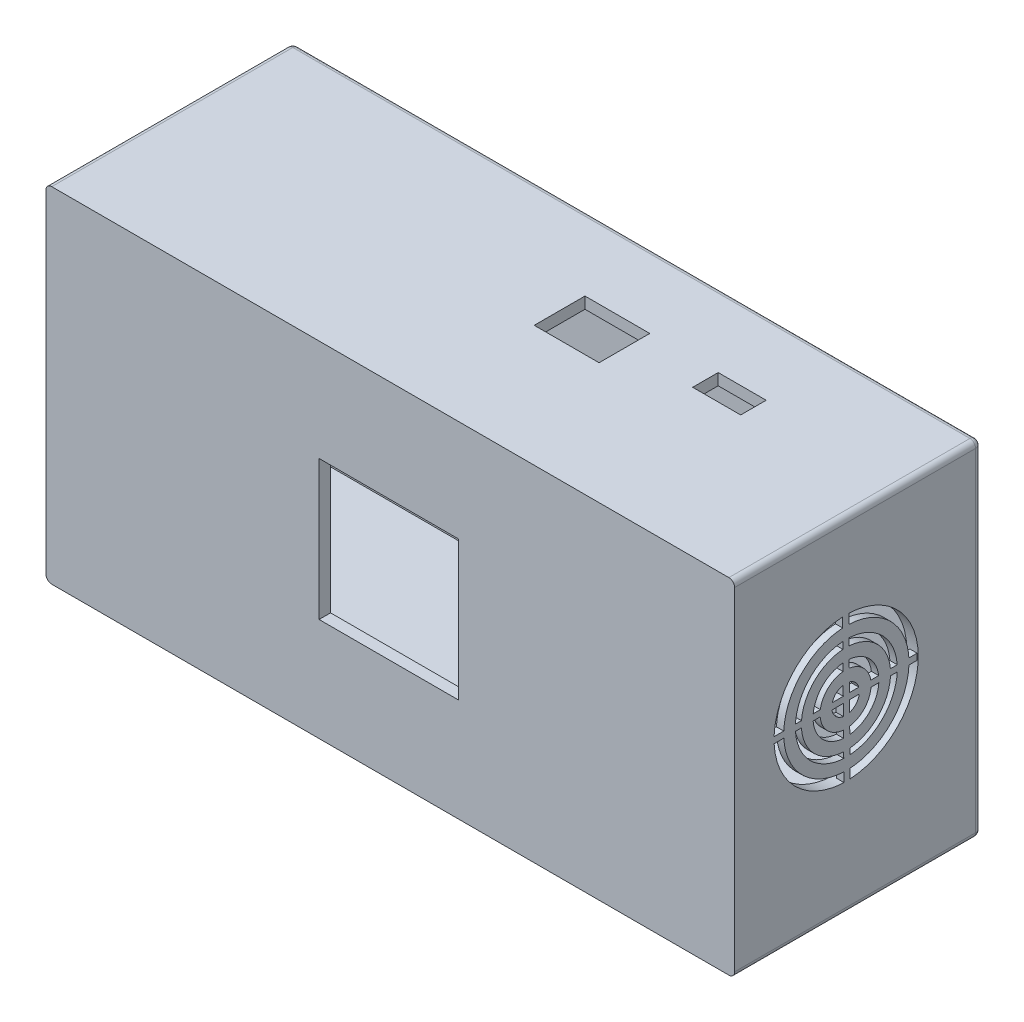
from build123d import *

# Parameters (mm, degrees)
BOSS_EXTRUDE2_DEPTH      = 30
BOSS_EXTRUDE2_DEPTH_BACK = 10
SKETCH2_W                = 120
SKETCH2_H                = 60
SHELL13_T                = -2
FILLET1_R                = 1
SKETCH4_W                = 8.361444153
SKETCH4_H                = 4.445115568
CUT_EXTRUDE1_DEPTH       = 9
SKETCH5_W                = 11.295048397
SKETCH5_H                = 8.838555995
CUT_EXTRUDE2_DEPTH       = 14
VENT2_START              = 134.27224921
VENT2_DEPTH              = 2
VENT2_2_DEPTH            = 0.73
SKETCH10_W               = 24.3
SKETCH10_H               = 24.3
CUT_EXTRUDE3_DEPTH       = 6
BOSS_EXTRUDE5_DEPTH      = 3
FILLET2_R                = 1


# Read off the part's stored shape, not the designer's step: Vent2
with BuildPart() as part:
    # Sketch2 → Boss-Extrude2 (new, two sides: drawn at the far end of the back side and taken through both)
    with BuildSketch(Plane.XY.offset(-BOSS_EXTRUDE2_DEPTH_BACK)):
        with Locations((76.27224921, 49.186903688)):
            Rectangle(SKETCH2_W, SKETCH2_H)
    extrude(amount=BOSS_EXTRUDE2_DEPTH + BOSS_EXTRUDE2_DEPTH_BACK)

    # Shell13
    shell13_openings = [part.faces().sort_by_distance(p)[0] for p in [
        (76.27224921, 49.186903688, -10),
    ]]
    offset(amount=SHELL13_T, openings=shell13_openings, kind=Kind.INTERSECTION)

    # Fillet1
    fillet1_edges = [part.edges().sort_by_distance(p)[0] for p in [
        (16.27224921, 79.186903688, 10),
        (136.27224921, 79.186903688, 10),
        (136.27224921, 19.186903688, 10),
        (16.27224921, 19.186903688, 10),
    ]]
    fillet(fillet1_edges, radius=FILLET1_R)

    # Sketch4 → Cut-Extrude1 (cut)
    with BuildSketch(Plane(origin=(0, 79.186903688, 0), x_dir=(1, 0, 0), z_dir=(0, 1, 0))):
        with Locations((107.573936677, -2.207545793)):
            Rectangle(SKETCH4_W, SKETCH4_H)
    extrude(amount=-CUT_EXTRUDE1_DEPTH, mode=Mode.SUBTRACT)

    # Sketch5 → Cut-Extrude2 (cut)
    with BuildSketch(Plane(origin=(0, 79.186903688, 0), x_dir=(1, 0, 0), z_dir=(0, 1, 0))):
        with Locations((85.887283166, -4.464716732)):
            Rectangle(SKETCH5_W, SKETCH5_H)
    extrude(amount=-CUT_EXTRUDE2_DEPTH, mode=Mode.SUBTRACT)

    # Vent2 outline → Vent2 (cut)
    with BuildSketch(Plane.YZ.offset(VENT2_START)):
        with BuildLine():
            add(Edge.make_bspline(
                [(39.248170727, 9.867726147), (39.280937663, 9.278831556), (39.458602574, 7.874335052), (40.110393686, 5.725667709), (41.279007407, 3.539345213), (42.851696903, 1.623017518), (44.768024598, 0.050328023), (46.954347093, -1.118285698), (49.326645243, -1.837914474), (50.971383719, -1.999907075), (51.793752958, -1.999907075)],
                knots=[0.758837586, 0.758837586, 0.758837586, 0.758837586, 0.78125, 0.8125, 0.84375, 0.875, 0.90625, 0.9375, 0.96875, 1, 1, 1, 1], degree=3))
            add(Edge.make_bspline(
                [(51.793752958, -1.999907075), (52.616122196, -1.999907075), (54.260860673, -1.837914474), (56.633158822, -1.118285698), (58.819481318, 0.050328023), (60.735809013, 1.623017518), (62.308498508, 3.539345213), (63.477112229, 5.725667709), (64.151568432, 7.949051843), (64.325410606, 9.433533895), (64.350126891, 10.100582883)],
                knots=[0, 0, 0, 0, 0.03125, 0.0625, 0.09375, 0.125, 0.15625, 0.1875, 0.21875, 0.24411512, 0.24411512, 0.24411512, 0.24411512], degree=3))
            Line((64.350126891, 10.100582883), (62.670243261, 10.084999581))
            add(Edge.make_bspline(
                [(52.380334311, -0.368908259), (52.887508336, -0.340055386), (54.10332287, -0.185490504), (55.96610058, 0.379576937), (57.865956786, 1.395071236), (59.531194679, 2.761696656), (60.897820099, 4.426934548), (61.913314398, 6.326790755), (62.495168538, 8.244906796), (62.647050219, 9.519932466), (62.670243261, 10.084999581)],
                knots=[0.009035738, 0.009035738, 0.009035738, 0.009035738, 0.03125, 0.0625, 0.09375, 0.125, 0.15625, 0.1875, 0.21875, 0.243480904, 0.243480904, 0.243480904, 0.243480904], degree=3))
            Line((52.380334311, -0.368908259), (52.388470355, -1.792712054))
            Line((52.388470355, -1.792712054), (51.308487987, -1.798883382))
            Line((51.308487987, -1.798883382), (51.300361801, -0.376797184))
            add(Edge.make_bspline(
                [(40.861511133, 9.882692243), (40.891158739, 9.385553011), (41.046097527, 8.179979941), (41.608256321, 6.326790755), (42.62375062, 4.426934548), (43.99037604, 2.761696656), (45.655613933, 1.395071236), (47.555470139, 0.379576937), (49.469314036, -0.200981262), (50.739762235, -0.353101983), (51.300361801, -0.376797184)],
                knots=[0.759471799, 0.759471799, 0.759471799, 0.759471799, 0.78125, 0.8125, 0.84375, 0.875, 0.90625, 0.9375, 0.96875, 0.993286618, 0.993286618, 0.993286618, 0.993286618], degree=3))
            Line((40.861511133, 9.882692243), (39.248170727, 9.867726147))
        make_face()
        with BuildLine():
            Line((62.661034502, 11.164960564), (64.343621962, 11.180569007))
            add(Edge.make_bspline(
                [(64.343621962, 11.180569007), (64.313355134, 11.796952588), (64.136872655, 13.229540791), (63.477112229, 15.404479438), (62.308498508, 17.590801933), (60.735809013, 19.507129628), (58.819481318, 21.079819124), (56.633158822, 22.248432845), (54.40588016, 22.92407044), (52.917221216, 23.097674464), (52.246101191, 23.121891543)],
                knots=[0.257799379, 0.257799379, 0.257799379, 0.257799379, 0.28125, 0.3125, 0.34375, 0.375, 0.40625, 0.4375, 0.46875, 0.494269027, 0.494269027, 0.494269027, 0.494269027], degree=3))
            Line((52.246101191, 23.121891543), (52.255714862, 21.439495978))
            add(Edge.make_bspline(
                [(62.661034502, 11.164960564), (62.631820789, 11.667664065), (62.477086008, 12.878915266), (61.913314398, 14.737421195), (60.897820099, 16.637277402), (59.531194679, 18.302515294), (57.865956786, 19.669140715), (55.96610058, 20.684635014), (54.063327221, 21.261835002), (52.804735823, 21.414550319), (52.255714862, 21.439495978)],
                knots=[0.259230008, 0.259230008, 0.259230008, 0.259230008, 0.28125, 0.3125, 0.34375, 0.375, 0.40625, 0.4375, 0.46875, 0.492783159, 0.492783159, 0.492783159, 0.492783159], degree=3))
        make_face()
        with BuildLine():
            add(Edge.make_bspline(
                [(51.166126705, 23.114341033), (50.55381606, 23.083681115), (49.125392776, 22.907012352), (46.954347093, 22.248432845), (44.768024598, 21.079819124), (42.851696903, 19.507129628), (41.279007407, 17.590801933), (40.110393686, 15.404479438), (39.427968143, 13.154823911), (39.255807145, 11.642150859), (39.234611352, 10.947646831)],
                knots=[0.507953224, 0.507953224, 0.507953224, 0.507953224, 0.53125, 0.5625, 0.59375, 0.625, 0.65625, 0.6875, 0.71875, 0.74515333, 0.74515333, 0.74515333, 0.74515333], degree=3))
            Line((39.234611352, 10.947646831), (40.850659779, 10.96263799))
            add(Edge.make_bspline(
                [(51.175722808, 21.435027445), (50.656963919, 21.407160408), (49.429318363, 21.253060658), (47.555470139, 20.684635014), (45.655613933, 19.669140715), (43.99037604, 18.302515294), (42.62375062, 16.637277402), (41.608256321, 14.737421195), (41.024789359, 12.813988393), (40.873212619, 11.533264495), (40.850659779, 10.96263799)],
                knots=[0.50853228, 0.50853228, 0.50853228, 0.50853228, 0.53125, 0.5625, 0.59375, 0.625, 0.65625, 0.6875, 0.71875, 0.743722697, 0.743722697, 0.743722697, 0.743722697], degree=3))
            Line((51.175722808, 21.435027445), (51.166126705, 23.114341033))
        make_face()
        with BuildLine():
            Line((51.49540607, 23.126502834), (51.948866287, 23.129094035))
            add(Edge.make_bspline(
                [(51.948866287, 23.129094035), (51.897164462, 23.129734031), (51.74600043, 23.130670123), (51.594836397, 23.128869508), (51.49540607, 23.126502834)],
                knots=[0.498035183, 0.498035183, 0.498035183, 0.498035183, 0.5, 0.503779411, 0.503779411, 0.503779411, 0.503779411], degree=3))
        make_face()
        with BuildLine():
            Line((51.235014551, 11.058967826), (51.223655638, 13.046777745))
            add(Edge.make_bspline(
                [(51.223655638, 13.046777745), (51.20159643, 13.04304306), (51.023956897, 13.010369071), (50.69850441, 12.910670807), (50.277256195, 12.687050931), (49.909554957, 12.383598671), (49.605947975, 12.015796131), (49.382362479, 11.594729628), (49.279713356, 11.259781995), (49.246422345, 11.072360016), (49.241426593, 11.040474431)],
                knots=[0.526810101, 0.526810101, 0.526810101, 0.526810101, 0.531231233, 0.562499636, 0.593731233, 0.624999636, 0.656231232, 0.687499636, 0.718731232, 0.725108759, 0.725108759, 0.725108759, 0.725108759], degree=3))
            Line((49.241426593, 11.040474431), (51.235014551, 11.058967826))
        make_face()
        with BuildLine():
            add(Edge.make_bspline(
                [(51.211966215, 15.092966778), (51.060663035, 15.078721907), (50.621605753, 15.014614553), (49.915539117, 14.800431581), (49.141478774, 14.386687708), (48.463009209, 13.829882126), (47.906203627, 13.151412561), (47.492459753, 12.377352218), (47.272475493, 11.652161297), (47.208546091, 11.192790385), (47.194729727, 11.021485687)],
                knots=[0.514938952, 0.514938952, 0.514938952, 0.514938952, 0.53125, 0.5625, 0.59375, 0.625, 0.65625, 0.6875, 0.71875, 0.737195698, 0.737195698, 0.737195698, 0.737195698], degree=3))
            Line((51.211966215, 15.092966778), (51.204938684, 16.322249183))
            add(Edge.make_bspline(
                [(51.204938684, 16.322249183), (50.982281858, 16.304468753), (50.387751024, 16.221970063), (49.450180919, 15.937561281), (48.450989448, 15.403482313), (47.575190799, 14.684732937), (46.856441423, 13.808934288), (46.322362455, 12.809742818), (46.033547307, 11.857646871), (45.951353916, 11.247652989), (45.934245061, 11.009795534)],
                knots=[0.51267793, 0.51267793, 0.51267793, 0.51267793, 0.53125, 0.5625, 0.59375, 0.625, 0.65625, 0.6875, 0.71875, 0.738578126, 0.738578126, 0.738578126, 0.738578126], degree=3))
            Line((45.934245061, 11.009795534), (47.194729727, 11.021485687))
        make_face()
        with BuildLine():
            Line((51.241185918, 9.978978607), (49.316567476, 9.961125017))
            add(Edge.make_bspline(
                [(49.316567476, 9.961125017), (49.339540747, 9.88593295), (49.419747427, 9.662873816), (49.605840344, 9.312317375), (49.909292887, 8.944617186), (50.277094371, 8.641006293), (50.698206996, 8.417413003), (51.032662666, 8.314881809), (51.21957636, 8.281625953), (51.250913245, 8.27669649)],
                knots=[0.79696703, 0.79696703, 0.79696703, 0.79696703, 0.812499636, 0.843731232, 0.874999635, 0.906231232, 0.937499635, 0.968740621, 0.975009024, 0.975009024, 0.975009024, 0.975009024], degree=3))
            Line((51.250913245, 8.27669649), (51.241185918, 9.978978607))
        make_face()
        with BuildLine():
            add(Edge.make_bspline(
                [(47.239330665, 9.941856548), (47.247343897, 9.893128105), (47.308200527, 9.558021785), (47.492459753, 8.950600519), (47.906203627, 8.176540176), (48.463009209, 7.498070611), (49.141478774, 6.941265029), (49.915539117, 6.527521155), (50.637900114, 6.308395342), (51.094261818, 6.244423062), (51.262605771, 6.230509649)],
                knots=[0.775949733, 0.775949733, 0.775949733, 0.775949733, 0.78125, 0.8125, 0.84375, 0.875, 0.90625, 0.9375, 0.96875, 0.986879822, 0.986879822, 0.986879822, 0.986879822], degree=3))
            Line((47.239330665, 9.941856548), (45.958458963, 9.929973722))
            add(Edge.make_bspline(
                [(45.958458963, 9.929973722), (45.976213387, 9.778362814), (46.058581332, 9.255909351), (46.322362455, 8.386339526), (46.856441423, 7.387148055), (47.575190799, 6.511349406), (48.450989448, 5.79260003), (49.450180919, 5.258521062), (50.408785842, 4.967731438), (51.025716232, 4.88571291), (51.270385933, 4.868982505)],
                knots=[0.768557942, 0.768557942, 0.768557942, 0.768557942, 0.78125, 0.8125, 0.84375, 0.875, 0.90625, 0.9375, 0.96875, 0.98914096, 0.98914096, 0.98914096, 0.98914096], degree=3))
            Line((51.270385933, 4.868982505), (51.262605771, 6.230509649))
        make_face()
        with BuildLine():
            Line((52.321146304, 9.988996792), (52.330504799, 8.35126018))
            add(Edge.make_bspline(
                [(52.330504799, 8.35126018), (52.406129897, 8.374314763), (52.629631041, 8.45459332), (52.980572907, 8.640904881), (53.348275198, 8.944353242), (53.651881898, 9.312156826), (53.845067399, 9.675972294), (53.928299986, 9.914170555), (53.953973461, 10.004151)],
                knots=[0.046880456, 0.046880456, 0.046880456, 0.046880456, 0.062499637, 0.093731233, 0.124999636, 0.156231233, 0.187499636, 0.205986908, 0.205986908, 0.205986908, 0.205986908], degree=3))
            Line((53.953973461, 10.004151), (52.321146304, 9.988996792))
        make_face()
        with BuildLine():
            add(Edge.make_bspline(
                [(52.342380699, 6.272977693), (52.394010027, 6.281363432), (52.732058919, 6.342409333), (53.342290816, 6.527521155), (54.116351159, 6.941265029), (54.794820724, 7.498070611), (55.351626306, 8.176540176), (55.765370179, 8.950600519), (55.957654118, 9.584475715), (56.020067765, 9.947322468), (56.031135508, 10.023416235)],
                knots=[0.025636011, 0.025636011, 0.025636011, 0.025636011, 0.03125, 0.0625, 0.09375, 0.125, 0.15625, 0.1875, 0.21875, 0.227003051, 0.227003051, 0.227003051, 0.227003051], degree=3))
            Line((52.342380699, 6.272977693), (52.350243254, 4.897030574))
            add(Edge.make_bspline(
                [(52.350243254, 4.897030574), (52.495027084, 4.914507316), (53.010564601, 4.996726926), (53.873584211, 5.258521062), (54.872775681, 5.79260003), (55.74857433, 6.511349406), (56.467323706, 7.387148055), (57.001402674, 8.386339526), (57.275542063, 9.290055977), (57.358297, 9.848639475), (57.376716608, 10.035894499)],
                knots=[0.019124342, 0.019124342, 0.019124342, 0.019124342, 0.03125, 0.0625, 0.09375, 0.125, 0.15625, 0.1875, 0.21875, 0.234394731, 0.234394731, 0.234394731, 0.234394731], degree=3))
            Line((57.376716608, 10.035894499), (56.031135508, 10.023416235))
        make_face()
        with BuildLine():
            add(Edge.make_bspline(
                [(56.055703794, 11.103683561), (56.041436032, 11.247327412), (55.977330048, 11.678614173), (55.765370179, 12.377352218), (55.351626306, 13.151412561), (54.794820724, 13.829882126), (54.116351159, 14.386687708), (53.342290816, 14.800431581), (52.715762446, 14.990486884), (52.360629829, 15.052518485), (52.292149312, 15.062839328)],
                knots=[0.265756968, 0.265756968, 0.265756968, 0.265756968, 0.28125, 0.3125, 0.34375, 0.375, 0.40625, 0.4375, 0.46875, 0.476182999, 0.476182999, 0.476182999, 0.476182999], degree=3))
            Line((56.055703794, 11.103683561), (57.380892972, 11.115979665))
            add(Edge.make_bspline(
                [(57.380892972, 11.115979665), (57.362584345, 11.318112644), (57.279859511, 11.891793645), (57.001402674, 12.809742818), (56.467323706, 13.808934288), (55.74857433, 14.684732937), (54.872775681, 15.403482313), (53.873584211, 15.937561281), (52.989528267, 16.20573672), (52.451763006, 16.288348009), (52.285040884, 16.306545063)],
                knots=[0.26437456, 0.26437456, 0.26437456, 0.26437456, 0.28125, 0.3125, 0.34375, 0.375, 0.40625, 0.4375, 0.46875, 0.482694679, 0.482694679, 0.482694679, 0.482694679], degree=3))
            Line((52.285040884, 16.306545063), (52.292149312, 15.062839328))
        make_face()
        with BuildLine():
            Line((52.314974937, 11.068986011), (54.009045181, 11.084700948))
            add(Edge.make_bspline(
                [(54.009045181, 11.084700948), (54.006071592, 11.101582503), (53.973767552, 11.273961959), (53.875609406, 11.594386924), (53.651989529, 12.01563514), (53.348537269, 12.383336378), (52.980734729, 12.68694336), (52.621624544, 12.87763017), (52.388743524, 12.959841185), (52.304020676, 12.984620421)],
                knots=[0.277843885, 0.277843885, 0.277843885, 0.277843885, 0.281231233, 0.312499636, 0.343731233, 0.374999636, 0.406231233, 0.437499636, 0.454939434, 0.454939434, 0.454939434, 0.454939434], degree=3))
            Line((52.304020676, 12.984620421), (52.314974937, 11.068986011))
        make_face()
        with BuildLine():
            add(Edge.make_bspline(
                [(51.193303967, 18.358323316), (50.841398777, 18.337056221), (49.985106618, 18.22666083), (48.667555542, 17.826986081), (47.314793506, 17.103919708), (46.129087664, 16.130836072), (45.156004028, 14.945130231), (44.432937656, 13.592368195), (44.025889453, 12.2505101), (43.916509367, 11.368242295), (43.897394672, 10.990900836)],
                knots=[0.509598418, 0.509598418, 0.509598418, 0.509598418, 0.53125, 0.5625, 0.59375, 0.625, 0.65625, 0.6875, 0.71875, 0.741954063, 0.741954063, 0.741954063, 0.741954063], degree=3))
            Line((51.193303967, 18.358323316), (51.187350447, 19.400192925))
            add(Edge.make_bspline(
                [(51.187350447, 19.400192925), (50.797815068, 19.374985655), (49.831986423, 19.248377067), (48.338095516, 18.795210214), (46.791809875, 17.96870332), (45.436479175, 16.85641216), (44.324188015, 15.50108146), (43.49768112, 13.954795818), (43.032435149, 12.421085391), (42.907402146, 11.412721136), (42.885541946, 10.981514445)],
                knots=[0.510277121, 0.510277121, 0.510277121, 0.510277121, 0.53125, 0.5625, 0.59375, 0.625, 0.65625, 0.6875, 0.71875, 0.74194784, 0.74194784, 0.74194784, 0.74194784], degree=3))
            Line((42.885541946, 10.981514445), (43.897394672, 10.990900836))
        make_face()
        with BuildLine():
            add(Edge.make_bspline(
                [(43.917887514, 9.911044499), (43.942593597, 9.6326008), (44.054559087, 8.851061126), (44.432937656, 7.603714149), (45.156004028, 6.250952113), (46.129087664, 5.065246271), (47.314793506, 4.092162635), (48.667555542, 3.369096263), (50.013584857, 2.960782734), (50.900315079, 2.85160127), (51.282020639, 2.832905764)],
                knots=[0.764082333, 0.764082333, 0.764082333, 0.764082333, 0.78125, 0.8125, 0.84375, 0.875, 0.90625, 0.9375, 0.96875, 0.992220478, 0.992220478, 0.992220478, 0.992220478], degree=3))
            Line((43.917887514, 9.911044499), (42.896577933, 9.901570388))
            add(Edge.make_bspline(
                [(42.896577933, 9.901570388), (42.922936128, 9.531234231), (43.050078908, 8.584962879), (43.49768112, 7.109416132), (44.324188015, 5.563130491), (45.436479175, 4.207799791), (46.791809875, 3.095508631), (48.338095516, 2.269001736), (49.864538671, 1.805960267), (50.865131501, 1.680597219), (51.288734165, 1.65803939)],
                knots=[0.761302123, 0.761302123, 0.761302123, 0.761302123, 0.78125, 0.8125, 0.84375, 0.875, 0.90625, 0.9375, 0.96875, 0.991541773, 0.991541773, 0.991541773, 0.991541773], degree=3))
            Line((51.288734165, 1.65803939), (51.282020639, 2.832905764))
        make_face()
        with BuildLine():
            add(Edge.make_bspline(
                [(52.361910758, 2.855213433), (52.635969059, 2.879994584), (53.413056196, 2.991989804), (54.656209588, 3.369096263), (56.008971624, 4.092162635), (57.194677465, 5.065246271), (58.167761101, 6.250952113), (58.890827474, 7.603714149), (59.283229716, 8.897290982), (59.394388849, 9.728010389), (59.417293872, 10.054823801)],
                knots=[0.014350176, 0.014350176, 0.014350176, 0.014350176, 0.03125, 0.0625, 0.09375, 0.125, 0.15625, 0.1875, 0.21875, 0.238870354, 0.238870354, 0.238870354, 0.238870354], degree=3))
            Line((52.361910758, 2.855213433), (52.368704434, 1.666317805))
            add(Edge.make_bspline(
                [(52.368704434, 1.666317805), (52.746645937, 1.692249555), (53.700661716, 1.819195182), (55.183475203, 2.269001736), (56.729760844, 3.095508631), (58.085091544, 4.207799791), (59.197382704, 5.563130491), (60.023889599, 7.109416132), (60.487521742, 8.637806481), (60.612798219, 9.640481217), (60.635172927, 10.066121381)],
                knots=[0.010896085, 0.010896085, 0.010896085, 0.010896085, 0.03125, 0.0625, 0.09375, 0.125, 0.15625, 0.1875, 0.21875, 0.241650575, 0.241650575, 0.241650575, 0.241650575], degree=3))
            Line((60.635172927, 10.066121381), (59.417293872, 10.054823801))
        make_face()
        with BuildLine():
            add(Edge.make_bspline(
                [(59.417738679, 11.134874322), (59.394954972, 11.463834556), (59.283851951, 12.296740128), (58.890827474, 13.592368195), (58.167761101, 14.945130231), (57.194677465, 16.130836072), (56.008971624, 17.103919708), (54.656209588, 17.826986081), (53.384578128, 18.212731266), (52.577226171, 18.324382601), (52.273378449, 18.348365277)],
                knots=[0.260998634, 0.260998634, 0.260998634, 0.260998634, 0.28125, 0.3125, 0.34375, 0.375, 0.40625, 0.4375, 0.46875, 0.48746871, 0.48746871, 0.48746871, 0.48746871], degree=3))
            Line((59.417738679, 11.134874322), (60.626155719, 11.146084125))
            add(Edge.make_bspline(
                [(60.626155719, 11.146084125), (60.600105939, 11.521988228), (60.473105637, 12.473929001), (60.023889599, 13.954795818), (59.197382704, 15.50108146), (58.085091544, 16.85641216), (56.729760844, 17.96870332), (55.183475203, 18.795210214), (53.668109494, 19.254891377), (52.679355327, 19.380721009), (52.267344737, 19.404267663)],
                knots=[0.261004857, 0.261004857, 0.261004857, 0.261004857, 0.28125, 0.3125, 0.34375, 0.375, 0.40625, 0.4375, 0.46875, 0.490922808, 0.490922808, 0.490922808, 0.490922808], degree=3))
            Line((52.267344737, 19.404267663), (52.273378449, 18.348365277))
        make_face()
    extrude(amount=VENT2_DEPTH, mode=Mode.SUBTRACT)

    # Vent2 2 outline → Vent2 2 (cut)
    with BuildSketch(Plane.YZ.offset(VENT2_START)):
        with BuildLine():
            Line((62.670243261, 10.084999581), (64.350126891, 10.100582883))
            add(Edge.make_bspline(
                [(64.350126891, 10.100582883), (64.355861236, 10.255342762), (64.36254043, 10.615455198), (64.353688326, 10.975567635), (64.343621962, 11.180569007)],
                knots=[0.24411512, 0.24411512, 0.24411512, 0.24411512, 0.25, 0.257799379, 0.257799379, 0.257799379, 0.257799379], degree=3))
            Line((64.343621962, 11.180569007), (62.661034502, 11.164960564))
            add(Edge.make_bspline(
                [(62.661034502, 11.164960564), (62.631820789, 11.667664065), (62.477086008, 12.878915266), (61.913314398, 14.737421195), (60.897820099, 16.637277402), (59.531194679, 18.302515294), (57.865956786, 19.669140715), (55.96610058, 20.684635014), (54.063327221, 21.261835002), (52.804735823, 21.414550319), (52.255714862, 21.439495978)],
                knots=[0.259230008, 0.259230008, 0.259230008, 0.259230008, 0.28125, 0.3125, 0.34375, 0.375, 0.40625, 0.4375, 0.46875, 0.492783159, 0.492783159, 0.492783159, 0.492783159], degree=3))
            Line((52.255714862, 21.439495978), (52.246101191, 23.121891543))
            add(Edge.make_bspline(
                [(52.246101191, 23.121891543), (52.14705576, 23.125465555), (52.047968238, 23.127867294), (51.948866287, 23.129094035)],
                knots=[0.494269027, 0.494269027, 0.494269027, 0.494269027, 0.498035183, 0.498035183, 0.498035183, 0.498035183], degree=3))
            Line((51.948866287, 23.129094035), (51.49540607, 23.126502834))
            add(Edge.make_bspline(
                [(51.49540607, 23.126502834), (51.385599641, 23.123889185), (51.275827303, 23.119834015), (51.166126705, 23.114341033)],
                knots=[0.503779411, 0.503779411, 0.503779411, 0.503779411, 0.507953224, 0.507953224, 0.507953224, 0.507953224], degree=3))
            Line((51.166126705, 23.114341033), (51.175722808, 21.435027445))
            add(Edge.make_bspline(
                [(51.175722808, 21.435027445), (50.656963919, 21.407160408), (49.429318363, 21.253060658), (47.555470139, 20.684635014), (45.655613933, 19.669140715), (43.99037604, 18.302515294), (42.62375062, 16.637277402), (41.608256321, 14.737421195), (41.024789359, 12.813988393), (40.873212619, 11.533264495), (40.850659779, 10.96263799)],
                knots=[0.50853228, 0.50853228, 0.50853228, 0.50853228, 0.53125, 0.5625, 0.59375, 0.625, 0.65625, 0.6875, 0.71875, 0.743722697, 0.743722697, 0.743722697, 0.743722697], degree=3))
            Line((40.850659779, 10.96263799), (39.234611352, 10.947646831))
            add(Edge.make_bspline(
                [(39.234611352, 10.947646831), (39.230720592, 10.820161712), (39.225219743, 10.460049368), (39.235250182, 10.099937024), (39.248170727, 9.867726147)],
                knots=[0.74515333, 0.74515333, 0.74515333, 0.74515333, 0.75, 0.758837586, 0.758837586, 0.758837586, 0.758837586], degree=3))
            Line((39.248170727, 9.867726147), (40.861511133, 9.882692243))
            add(Edge.make_bspline(
                [(40.861511133, 9.882692243), (40.891158739, 9.385553011), (41.046097527, 8.179979941), (41.608256321, 6.326790755), (42.62375062, 4.426934548), (43.99037604, 2.761696656), (45.655613933, 1.395071236), (47.555470139, 0.379576937), (49.469314036, -0.200981262), (50.739762235, -0.353101983), (51.300361801, -0.376797184)],
                knots=[0.759471799, 0.759471799, 0.759471799, 0.759471799, 0.78125, 0.8125, 0.84375, 0.875, 0.90625, 0.9375, 0.96875, 0.993286618, 0.993286618, 0.993286618, 0.993286618], degree=3))
            Line((51.300361801, -0.376797184), (51.308487987, -1.798883382))
            Line((51.308487987, -1.798883382), (52.388470355, -1.792712054))
            Line((52.388470355, -1.792712054), (52.380334311, -0.368908259))
            add(Edge.make_bspline(
                [(52.380334311, -0.368908259), (52.887508336, -0.340055386), (54.10332287, -0.185490504), (55.96610058, 0.379576937), (57.865956786, 1.395071236), (59.531194679, 2.761696656), (60.897820099, 4.426934548), (61.913314398, 6.326790755), (62.495168538, 8.244906796), (62.647050219, 9.519932466), (62.670243261, 10.084999581)],
                knots=[0.009035738, 0.009035738, 0.009035738, 0.009035738, 0.03125, 0.0625, 0.09375, 0.125, 0.15625, 0.1875, 0.21875, 0.243480904, 0.243480904, 0.243480904, 0.243480904], degree=3))
        make_face()
        with BuildLine():
            Line((42.896577933, 9.901570388), (43.917887514, 9.911044499))
            add(Edge.make_bspline(
                [(43.917887514, 9.911044499), (43.942593597, 9.6326008), (44.054559087, 8.851061126), (44.432937656, 7.603714149), (45.156004028, 6.250952113), (46.129087664, 5.065246271), (47.314793506, 4.092162635), (48.667555542, 3.369096263), (50.013584857, 2.960782734), (50.900315079, 2.85160127), (51.282020639, 2.832905764)],
                knots=[0.764082333, 0.764082333, 0.764082333, 0.764082333, 0.78125, 0.8125, 0.84375, 0.875, 0.90625, 0.9375, 0.96875, 0.992220478, 0.992220478, 0.992220478, 0.992220478], degree=3))
            Line((51.282020639, 2.832905764), (51.288734165, 1.65803939))
            add(Edge.make_bspline(
                [(42.896577933, 9.901570388), (42.922936128, 9.531234231), (43.050078908, 8.584962879), (43.49768112, 7.109416132), (44.324188015, 5.563130491), (45.436479175, 4.207799791), (46.791809875, 3.095508631), (48.338095516, 2.269001736), (49.864538671, 1.805960267), (50.865131501, 1.680597219), (51.288734165, 1.65803939)],
                knots=[0.761302123, 0.761302123, 0.761302123, 0.761302123, 0.78125, 0.8125, 0.84375, 0.875, 0.90625, 0.9375, 0.96875, 0.991541773, 0.991541773, 0.991541773, 0.991541773], degree=3))
        make_face(mode=Mode.SUBTRACT)
        with BuildLine():
            Line((45.958458963, 9.929973722), (47.239330665, 9.941856548))
            add(Edge.make_bspline(
                [(47.239330665, 9.941856548), (47.247343897, 9.893128105), (47.308200527, 9.558021785), (47.492459753, 8.950600519), (47.906203627, 8.176540176), (48.463009209, 7.498070611), (49.141478774, 6.941265029), (49.915539117, 6.527521155), (50.637900114, 6.308395342), (51.094261818, 6.244423062), (51.262605771, 6.230509649)],
                knots=[0.775949733, 0.775949733, 0.775949733, 0.775949733, 0.78125, 0.8125, 0.84375, 0.875, 0.90625, 0.9375, 0.96875, 0.986879822, 0.986879822, 0.986879822, 0.986879822], degree=3))
            Line((51.262605771, 6.230509649), (51.270385933, 4.868982505))
            add(Edge.make_bspline(
                [(45.958458963, 9.929973722), (45.976213387, 9.778362814), (46.058581332, 9.255909351), (46.322362455, 8.386339526), (46.856441423, 7.387148055), (47.575190799, 6.511349406), (48.450989448, 5.79260003), (49.450180919, 5.258521062), (50.408785842, 4.967731438), (51.025716232, 4.88571291), (51.270385933, 4.868982505)],
                knots=[0.768557942, 0.768557942, 0.768557942, 0.768557942, 0.78125, 0.8125, 0.84375, 0.875, 0.90625, 0.9375, 0.96875, 0.98914096, 0.98914096, 0.98914096, 0.98914096], degree=3))
        make_face(mode=Mode.SUBTRACT)
        with BuildLine():
            add(Edge.make_bspline(
                [(49.316567476, 9.961125017), (49.339540747, 9.88593295), (49.419747427, 9.662873816), (49.605840344, 9.312317375), (49.909292887, 8.944617186), (50.277094371, 8.641006293), (50.698206996, 8.417413003), (51.032662666, 8.314881809), (51.21957636, 8.281625953), (51.250913245, 8.27669649)],
                knots=[0.79696703, 0.79696703, 0.79696703, 0.79696703, 0.812499636, 0.843731232, 0.874999635, 0.906231232, 0.937499635, 0.968740621, 0.975009024, 0.975009024, 0.975009024, 0.975009024], degree=3))
            Line((49.316567476, 9.961125017), (51.241185918, 9.978978607))
            Line((51.241185918, 9.978978607), (51.250913245, 8.27669649))
        make_face(mode=Mode.SUBTRACT)
        with BuildLine():
            Line((52.368704434, 1.666317805), (52.361910758, 2.855213433))
            add(Edge.make_bspline(
                [(52.361910758, 2.855213433), (52.635969059, 2.879994584), (53.413056196, 2.991989804), (54.656209588, 3.369096263), (56.008971624, 4.092162635), (57.194677465, 5.065246271), (58.167761101, 6.250952113), (58.890827474, 7.603714149), (59.283229716, 8.897290982), (59.394388849, 9.728010389), (59.417293872, 10.054823801)],
                knots=[0.014350176, 0.014350176, 0.014350176, 0.014350176, 0.03125, 0.0625, 0.09375, 0.125, 0.15625, 0.1875, 0.21875, 0.238870354, 0.238870354, 0.238870354, 0.238870354], degree=3))
            Line((59.417293872, 10.054823801), (60.635172927, 10.066121381))
            add(Edge.make_bspline(
                [(52.368704434, 1.666317805), (52.746645937, 1.692249555), (53.700661716, 1.819195182), (55.183475203, 2.269001736), (56.729760844, 3.095508631), (58.085091544, 4.207799791), (59.197382704, 5.563130491), (60.023889599, 7.109416132), (60.487521742, 8.637806481), (60.612798219, 9.640481217), (60.635172927, 10.066121381)],
                knots=[0.010896085, 0.010896085, 0.010896085, 0.010896085, 0.03125, 0.0625, 0.09375, 0.125, 0.15625, 0.1875, 0.21875, 0.241650575, 0.241650575, 0.241650575, 0.241650575], degree=3))
        make_face(mode=Mode.SUBTRACT)
        with BuildLine():
            Line((52.350243254, 4.897030574), (52.342380699, 6.272977693))
            add(Edge.make_bspline(
                [(52.342380699, 6.272977693), (52.394010027, 6.281363432), (52.732058919, 6.342409333), (53.342290816, 6.527521155), (54.116351159, 6.941265029), (54.794820724, 7.498070611), (55.351626306, 8.176540176), (55.765370179, 8.950600519), (55.957654118, 9.584475715), (56.020067765, 9.947322468), (56.031135508, 10.023416235)],
                knots=[0.025636011, 0.025636011, 0.025636011, 0.025636011, 0.03125, 0.0625, 0.09375, 0.125, 0.15625, 0.1875, 0.21875, 0.227003051, 0.227003051, 0.227003051, 0.227003051], degree=3))
            Line((56.031135508, 10.023416235), (57.376716608, 10.035894499))
            add(Edge.make_bspline(
                [(52.350243254, 4.897030574), (52.495027084, 4.914507316), (53.010564601, 4.996726926), (53.873584211, 5.258521062), (54.872775681, 5.79260003), (55.74857433, 6.511349406), (56.467323706, 7.387148055), (57.001402674, 8.386339526), (57.275542063, 9.290055977), (57.358297, 9.848639475), (57.376716608, 10.035894499)],
                knots=[0.019124342, 0.019124342, 0.019124342, 0.019124342, 0.03125, 0.0625, 0.09375, 0.125, 0.15625, 0.1875, 0.21875, 0.234394731, 0.234394731, 0.234394731, 0.234394731], degree=3))
        make_face(mode=Mode.SUBTRACT)
        with BuildLine():
            add(Edge.make_bspline(
                [(52.330504799, 8.35126018), (52.406129897, 8.374314763), (52.629631041, 8.45459332), (52.980572907, 8.640904881), (53.348275198, 8.944353242), (53.651881898, 9.312156826), (53.845067399, 9.675972294), (53.928299986, 9.914170555), (53.953973461, 10.004151)],
                knots=[0.046880456, 0.046880456, 0.046880456, 0.046880456, 0.062499637, 0.093731233, 0.124999636, 0.156231233, 0.187499636, 0.205986908, 0.205986908, 0.205986908, 0.205986908], degree=3))
            Line((52.330504799, 8.35126018), (52.321146304, 9.988996792))
            Line((52.321146304, 9.988996792), (53.953973461, 10.004151))
        make_face(mode=Mode.SUBTRACT)
        with BuildLine():
            Line((51.204938684, 16.322249183), (51.211966215, 15.092966778))
            add(Edge.make_bspline(
                [(51.211966215, 15.092966778), (51.060663035, 15.078721907), (50.621605753, 15.014614553), (49.915539117, 14.800431581), (49.141478774, 14.386687708), (48.463009209, 13.829882126), (47.906203627, 13.151412561), (47.492459753, 12.377352218), (47.272475493, 11.652161297), (47.208546091, 11.192790385), (47.194729727, 11.021485687)],
                knots=[0.514938952, 0.514938952, 0.514938952, 0.514938952, 0.53125, 0.5625, 0.59375, 0.625, 0.65625, 0.6875, 0.71875, 0.737195698, 0.737195698, 0.737195698, 0.737195698], degree=3))
            Line((47.194729727, 11.021485687), (45.934245061, 11.009795534))
            add(Edge.make_bspline(
                [(51.204938684, 16.322249183), (50.982281858, 16.304468753), (50.387751024, 16.221970063), (49.450180919, 15.937561281), (48.450989448, 15.403482313), (47.575190799, 14.684732937), (46.856441423, 13.808934288), (46.322362455, 12.809742818), (46.033547307, 11.857646871), (45.951353916, 11.247652989), (45.934245061, 11.009795534)],
                knots=[0.51267793, 0.51267793, 0.51267793, 0.51267793, 0.53125, 0.5625, 0.59375, 0.625, 0.65625, 0.6875, 0.71875, 0.738578126, 0.738578126, 0.738578126, 0.738578126], degree=3))
        make_face(mode=Mode.SUBTRACT)
        with BuildLine():
            add(Edge.make_bspline(
                [(51.223655638, 13.046777745), (51.20159643, 13.04304306), (51.023956897, 13.010369071), (50.69850441, 12.910670807), (50.277256195, 12.687050931), (49.909554957, 12.383598671), (49.605947975, 12.015796131), (49.382362479, 11.594729628), (49.279713356, 11.259781995), (49.246422345, 11.072360016), (49.241426593, 11.040474431)],
                knots=[0.526810101, 0.526810101, 0.526810101, 0.526810101, 0.531231233, 0.562499636, 0.593731233, 0.624999636, 0.656231232, 0.687499636, 0.718731232, 0.725108759, 0.725108759, 0.725108759, 0.725108759], degree=3))
            Line((51.223655638, 13.046777745), (51.235014551, 11.058967826))
            Line((51.235014551, 11.058967826), (49.241426593, 11.040474431))
        make_face(mode=Mode.SUBTRACT)
        with BuildLine():
            Line((51.187350447, 19.400192925), (51.193303967, 18.358323316))
            add(Edge.make_bspline(
                [(51.193303967, 18.358323316), (50.841398777, 18.337056221), (49.985106618, 18.22666083), (48.667555542, 17.826986081), (47.314793506, 17.103919708), (46.129087664, 16.130836072), (45.156004028, 14.945130231), (44.432937656, 13.592368195), (44.025889453, 12.2505101), (43.916509367, 11.368242295), (43.897394672, 10.990900836)],
                knots=[0.509598418, 0.509598418, 0.509598418, 0.509598418, 0.53125, 0.5625, 0.59375, 0.625, 0.65625, 0.6875, 0.71875, 0.741954063, 0.741954063, 0.741954063, 0.741954063], degree=3))
            Line((43.897394672, 10.990900836), (42.885541946, 10.981514445))
            add(Edge.make_bspline(
                [(51.187350447, 19.400192925), (50.797815068, 19.374985655), (49.831986423, 19.248377067), (48.338095516, 18.795210214), (46.791809875, 17.96870332), (45.436479175, 16.85641216), (44.324188015, 15.50108146), (43.49768112, 13.954795818), (43.032435149, 12.421085391), (42.907402146, 11.412721136), (42.885541946, 10.981514445)],
                knots=[0.510277121, 0.510277121, 0.510277121, 0.510277121, 0.53125, 0.5625, 0.59375, 0.625, 0.65625, 0.6875, 0.71875, 0.74194784, 0.74194784, 0.74194784, 0.74194784], degree=3))
        make_face(mode=Mode.SUBTRACT)
        with BuildLine():
            add(Edge.make_bspline(
                [(54.009045181, 11.084700948), (54.006071592, 11.101582503), (53.973767552, 11.273961959), (53.875609406, 11.594386924), (53.651989529, 12.01563514), (53.348537269, 12.383336378), (52.980734729, 12.68694336), (52.621624544, 12.87763017), (52.388743524, 12.959841185), (52.304020676, 12.984620421)],
                knots=[0.277843885, 0.277843885, 0.277843885, 0.277843885, 0.281231233, 0.312499636, 0.343731233, 0.374999636, 0.406231233, 0.437499636, 0.454939434, 0.454939434, 0.454939434, 0.454939434], degree=3))
            Line((54.009045181, 11.084700948), (52.314974937, 11.068986011))
            Line((52.314974937, 11.068986011), (52.304020676, 12.984620421))
        make_face(mode=Mode.SUBTRACT)
        with BuildLine():
            Line((57.380892972, 11.115979665), (56.055703794, 11.103683561))
            add(Edge.make_bspline(
                [(56.055703794, 11.103683561), (56.041436032, 11.247327412), (55.977330048, 11.678614173), (55.765370179, 12.377352218), (55.351626306, 13.151412561), (54.794820724, 13.829882126), (54.116351159, 14.386687708), (53.342290816, 14.800431581), (52.715762446, 14.990486884), (52.360629829, 15.052518485), (52.292149312, 15.062839328)],
                knots=[0.265756968, 0.265756968, 0.265756968, 0.265756968, 0.28125, 0.3125, 0.34375, 0.375, 0.40625, 0.4375, 0.46875, 0.476182999, 0.476182999, 0.476182999, 0.476182999], degree=3))
            Line((52.292149312, 15.062839328), (52.285040884, 16.306545063))
            add(Edge.make_bspline(
                [(57.380892972, 11.115979665), (57.362584345, 11.318112644), (57.279859511, 11.891793645), (57.001402674, 12.809742818), (56.467323706, 13.808934288), (55.74857433, 14.684732937), (54.872775681, 15.403482313), (53.873584211, 15.937561281), (52.989528267, 16.20573672), (52.451763006, 16.288348009), (52.285040884, 16.306545063)],
                knots=[0.26437456, 0.26437456, 0.26437456, 0.26437456, 0.28125, 0.3125, 0.34375, 0.375, 0.40625, 0.4375, 0.46875, 0.482694679, 0.482694679, 0.482694679, 0.482694679], degree=3))
        make_face(mode=Mode.SUBTRACT)
        with BuildLine():
            Line((60.626155719, 11.146084125), (59.417738679, 11.134874322))
            add(Edge.make_bspline(
                [(59.417738679, 11.134874322), (59.394954972, 11.463834556), (59.283851951, 12.296740128), (58.890827474, 13.592368195), (58.167761101, 14.945130231), (57.194677465, 16.130836072), (56.008971624, 17.103919708), (54.656209588, 17.826986081), (53.384578128, 18.212731266), (52.577226171, 18.324382601), (52.273378449, 18.348365277)],
                knots=[0.260998634, 0.260998634, 0.260998634, 0.260998634, 0.28125, 0.3125, 0.34375, 0.375, 0.40625, 0.4375, 0.46875, 0.48746871, 0.48746871, 0.48746871, 0.48746871], degree=3))
            Line((52.273378449, 18.348365277), (52.267344737, 19.404267663))
            add(Edge.make_bspline(
                [(60.626155719, 11.146084125), (60.600105939, 11.521988228), (60.473105637, 12.473929001), (60.023889599, 13.954795818), (59.197382704, 15.50108146), (58.085091544, 16.85641216), (56.729760844, 17.96870332), (55.183475203, 18.795210214), (53.668109494, 19.254891377), (52.679355327, 19.380721009), (52.267344737, 19.404267663)],
                knots=[0.261004857, 0.261004857, 0.261004857, 0.261004857, 0.28125, 0.3125, 0.34375, 0.375, 0.40625, 0.4375, 0.46875, 0.490922808, 0.490922808, 0.490922808, 0.490922808], degree=3))
        make_face(mode=Mode.SUBTRACT)
    extrude(amount=VENT2_2_DEPTH, mode=Mode.SUBTRACT)

    # Sketch10 → Cut-Extrude3 (cut)
    with BuildSketch(Plane.XY.offset(30)):
        with Locations((76.008326514, 49.309770083)):
            Rectangle(SKETCH10_W, SKETCH10_H)
    extrude(amount=-CUT_EXTRUDE3_DEPTH, mode=Mode.SUBTRACT)

    # Sketch13 → Boss-Extrude5 (add)
    with BuildSketch(Plane(origin=(0, 0, -10), x_dir=(-1, 0, 0), z_dir=(0, 0, -1))):
        with BuildLine():
            Line((-136.27224921, 78.186903688), (-136.27224921, 20.186903688))
            ThreePointArc((-136.27224921, 20.186903688), (-135.979355992, 19.479796907), (-135.27224921, 19.186903688))
            Line((-135.27224921, 19.186903688), (-17.27224921, 19.186903688))
            ThreePointArc((-17.27224921, 19.186903688), (-16.565142429, 19.479796907), (-16.27224921, 20.186903688))
            Line((-16.27224921, 20.186903688), (-16.27224921, 78.186903688))
            ThreePointArc((-16.27224921, 78.186903688), (-16.565142429, 78.89401047), (-17.27224921, 79.186903688))
            Line((-17.27224921, 79.186903688), (-135.27224921, 79.186903688))
            ThreePointArc((-135.27224921, 79.186903688), (-135.979355992, 78.89401047), (-136.27224921, 78.186903688))
        make_face()
    extrude(amount=BOSS_EXTRUDE5_DEPTH)

    # Fillet2
    fillet2_edges = [part.edges().sort_by_distance(p)[0] for p in [
        (135.979355992, 78.89401047, -13),
        (136.27224921, 49.186903688, -13),
        (135.979355992, 19.479796907, -13),
        (76.27224921, 19.186903688, -13),
        (16.565142429, 19.479796907, -13),
        (16.27224921, 49.186903688, -13),
        (16.565142429, 78.89401047, -13),
        (76.27224921, 79.186903688, -13),
    ]]
    fillet(fillet2_edges, radius=FILLET2_R)


solid = part.part
